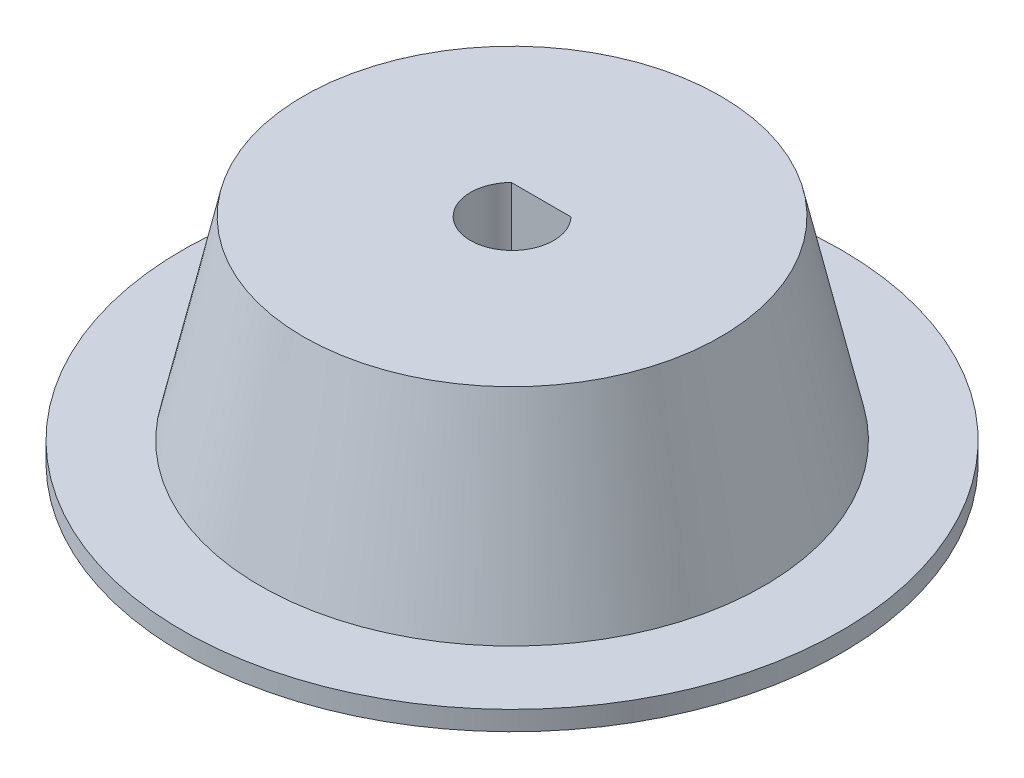
from build123d import *

# Parameters (mm, degrees)
SKETCH1_R           = 13
BOSS_EXTRUDE1_DEPTH = 10
SKETCH3_R           = 17
BOSS_EXTRUDE2_DEPTH = 1
CUT_EXTRUDE2_DEPTH  = 27.438608133


with BuildPart() as part:
    # Sketch1 → Boss-Extrude1 (new body)
    with BuildSketch(Plane(origin=(0, 0, 0), x_dir=(1, 0, 0), z_dir=(0, 1, 0))):
        Circle(SKETCH1_R)
    extrude(amount=BOSS_EXTRUDE1_DEPTH)

    # Sketch2 → Cut-Revolve1 (revolve, cut)
    with BuildSketch(Plane(origin=(0, 0, 0), x_dir=(0, 0, -1), z_dir=(1, 0, 0))):
        Polygon((-13, 0), (-10.757403894, 10), (-13, 10), align=None)
    revolve(axis=Axis((0, 0, 0), (0, 1, 0)), mode=Mode.SUBTRACT)

    # Sketch3 → Boss-Extrude2 (add)
    with BuildSketch(Plane(origin=(0, 0, 0), x_dir=(-1, 0, 0), z_dir=(0, -1, 0))):
        Circle(SKETCH3_R)
    extrude(amount=BOSS_EXTRUDE2_DEPTH)

    # Sketch5 → Cut-Extrude2 (cut, through all)
    with BuildSketch(Plane(origin=(0, 10, 0), x_dir=(1, 0, 0), z_dir=(0, 1, 0))):
        with BuildLine():
            Line((1.54029218, 1.5), (-1.54029218, 1.5))
            ThreePointArc((-1.54029218, 1.5), (-0.809589962, -1.991749004), (2.15, 0))
            ThreePointArc((2.15, 0), (1.991749004, 0.809589962), (1.54029218, 1.5))
        make_face()
    extrude(amount=-CUT_EXTRUDE2_DEPTH, mode=Mode.SUBTRACT)


solid = part.part
